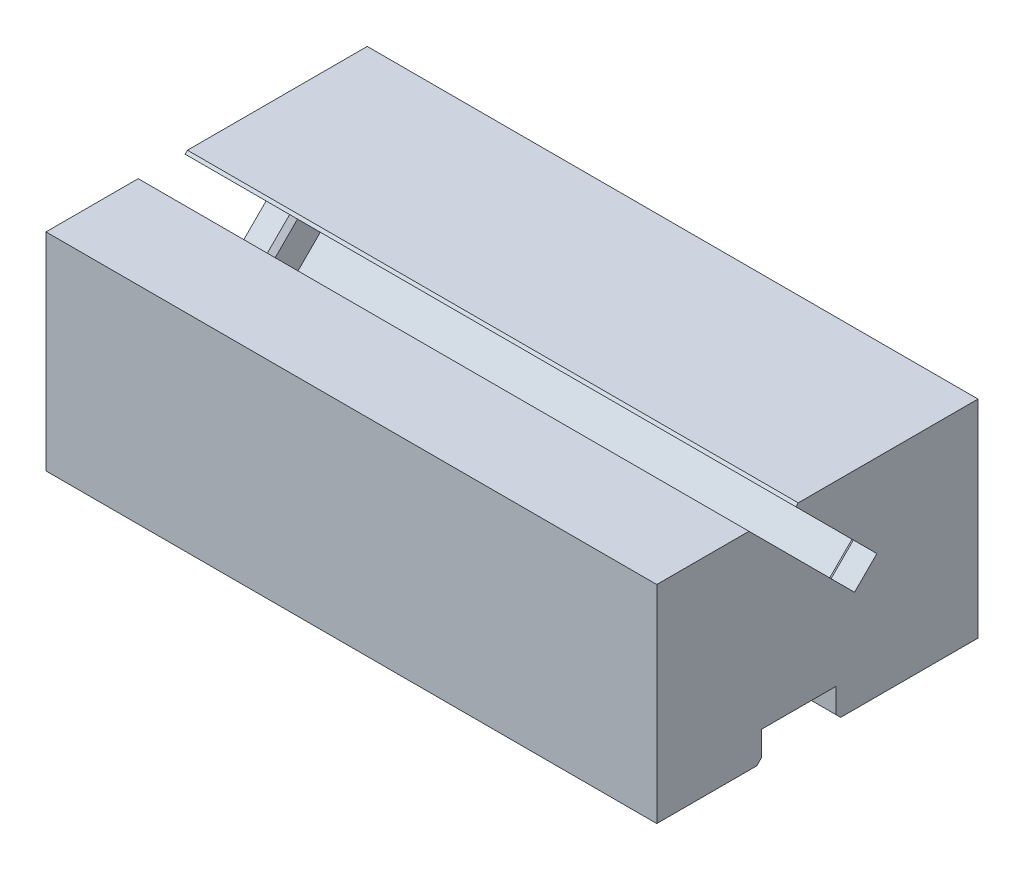
from build123d import *
from OCP.BRepFilletAPI import BRepFilletAPI_MakeChamfer

# Parameters (mm, degrees)
BOSS_EXTRUDE1_DEPTH = 66.25
BOSS_EXTRUDE2_DEPTH = 3.05
BOSS_EXTRUDE3_DEPTH = 3.175
SKETCH2_4_R         = 1.5
CUT_EXTRUDE1_DEPTH  = 3
CHAMFER1_SIZE       = 1.5
CHAMFER3_SIZE       = 2.675
CHAMFER4_SIZE       = 0.5
CHAMFER4_SIZE_2     = 0.353553391


with BuildPart() as part:
    # Sketch1 → Boss-Extrude1 (new body)
    with BuildSketch(Plane(origin=(0, 0, 0), x_dir=(0, 0, -1), z_dir=(1, 0, 0))):
        Polygon((14.843681451, 19.28355698), (34.843681451, 19.28355698), (34.843681451, 0), (0, 0), (0, 19.28355698), (10, 19.28355698), (24.28355698, 5), (26.705397706, 7.421840726), align=None)
    extrude(amount=BOSS_EXTRUDE1_DEPTH)

    # Sketch1<4> → Boss-Extrude2 (add)
    with BuildSketch(Plane(origin=(0, 0, 0), x_dir=(0, 0, -1), z_dir=(1, 0, 0))):
        Polygon((23.876970581, 10.25026785), (21.455129855, 7.828427125), (24.28355698, 5), (26.705397706, 7.421840726), align=None)
    boss_extrude2 = extrude(amount=BOSS_EXTRUDE2_DEPTH)

    # Mirror1: Boss-Extrude2 across plane
    add(boss_extrude2.mirror(Plane.ZY.offset(-33.125)))

    # Sketch2 → Boss-Extrude3 (add)
    with BuildSketch(Plane(origin=(0, 0, 0), x_dir=(1, 0, 0), z_dir=(0, 1, 0))):
        Polygon((0, 11.346840726), (0, 0), (66.25, 0), (66.25, 11.346840726), (63.2, 11.346840726), (63.2, 7.246840726), (3.05, 7.246840726), (3.05, 11.346840726), align=None)
        Polygon((0, 34.843681451), (0, 19.446840726), (3.05, 19.446840726), (3.05, 27.596840726), (63.2, 27.596840726), (63.2, 19.446840726), (66.25, 19.446840726), (66.25, 34.843681451), align=None)
    extrude(amount=-BOSS_EXTRUDE3_DEPTH)

    # Sketch2<4> → Cut-Extrude1 (cut)
    with BuildSketch(Plane(origin=(0, 0, 0), x_dir=(1, 0, 0), z_dir=(0, 1, 0))):
        with Locations(Location((54.05, 14.246840726, 0), (0, 0, 90))):
            Circle(SKETCH2_4_R)
        with Locations(Location((12.2, 14.246840726, 0), (0, 0, 90))):
            Circle(SKETCH2_4_R)
    extrude(amount=CUT_EXTRUDE1_DEPTH, mode=Mode.SUBTRACT)

    # Chamfer1
    chamfer1_edges = [part.edges().sort_by_distance(p)[0] for p in [
        (54.05, 3, -12.746840726),
        (54.05, 0, -12.746840726),
        (12.2, 0, -12.746840726),
        (12.2, 3, -12.746840726),
    ]]
    chamfer(chamfer1_edges, length=CHAMFER1_SIZE - 0.0001)  # a hair under: the kernel refuses the full size

    # Chamfer3
    chamfer3_edges = [part.edges().sort_by_distance(p)[0] for p in [
        (33.125, 0, -27.596840726),
    ]]
    chamfer(chamfer3_edges, length=CHAMFER3_SIZE)

    # Chamfer4
    chamfer4_edges_1 = [part.edges().sort_by_distance(p)[0] for p in [
        (3.05, 9.039347488, -22.666050218),
        (63.2, 9.039347488, -22.666050218),
        (3.05, -3.175, -23.521840726),
        (1.525, -3.175, -19.446840726),
        (63.2, -3.175, -23.521840726),
        (64.725, -3.175, -19.446840726),
        (1.525, -3.175, -11.346840726),
        (3.05, -3.175, -9.296840726),
        (33.125, -3.175, -7.246840726),
        (63.2, -3.175, -9.296840726),
        (64.725, -3.175, -11.346840726),
        (33.125, -3.175, -27.596840726),
    ]]
    chamfer4_edges_2 = [part.edges().sort_by_distance(p)[0] for p in [
        (33.125, 19.28355698, -14.843681451),
    ]]
    chamfer4_side_2 = [part.faces().sort_by_distance(p)[0] for p in [
        (33.125, 19.28355698, -14.850752519),
    ]]
    chamfer4 = BRepFilletAPI_MakeChamfer(part.part.solid().wrapped)
    for e in chamfer4_edges_1:
        chamfer4.Add(CHAMFER4_SIZE - 0.0001, e.wrapped)
    for e in chamfer4_edges_2:
        chamfer4.Add(CHAMFER4_SIZE - 0.0001, CHAMFER4_SIZE_2 - 0.0001, e.wrapped, chamfer4_side_2[0].wrapped)
    add(Compound.cast(chamfer4.Shape()), mode=Mode.REPLACE)  # a hair under: the kernel refuses the full size


solid = part.part
